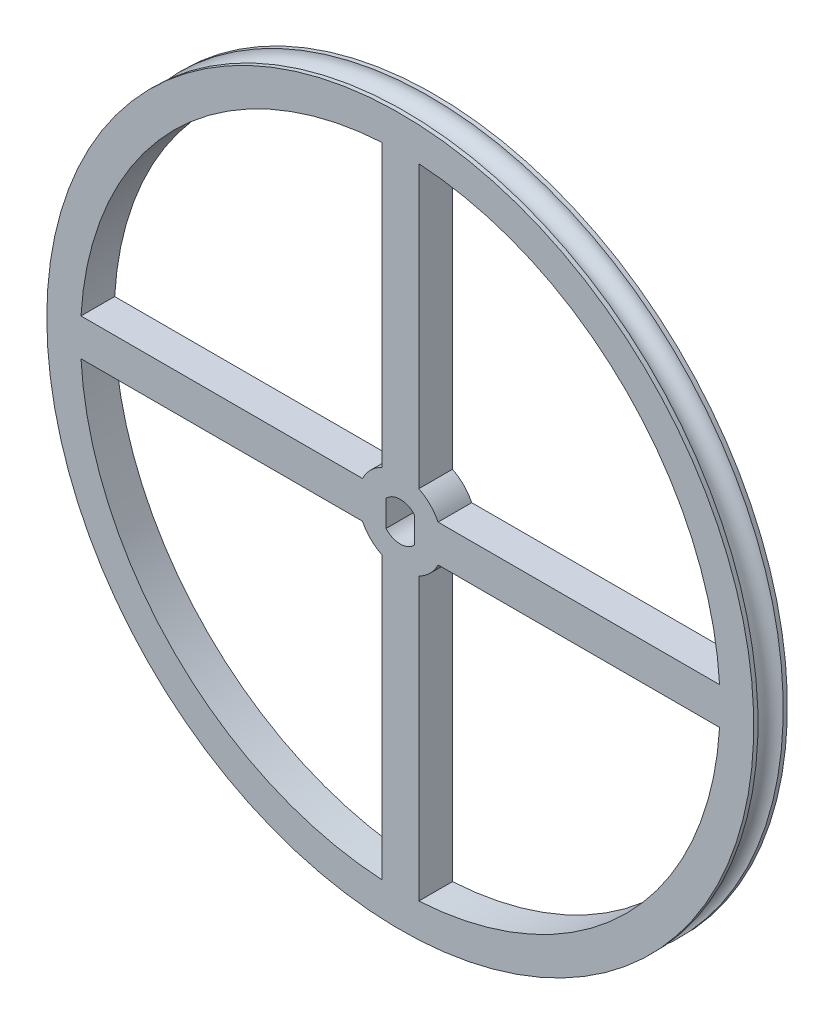
from build123d import *

# Parameters (mm, degrees)
CUT_EXTRUDE2_DEPTH = 76.605010416
CUT_EXTRUDE3_DEPTH = 76.605010416


with BuildPart() as part:
    # Sketch1 → Revolve1 (revolve)
    with BuildSketch(Plane(origin=(0, 0, 0), x_dir=(1, 0, 0), z_dir=(0, 1, 0))):
        with BuildLine():
            Line((-53.34, 0), (-53.34, -0.635))
            ThreePointArc((-53.34, -0.635), (-51.435, -2.54), (-53.34, -4.445))
            Line((-53.34, -4.445), (-53.34, -5.08))
            Line((-53.34, -5.08), (0, -5.08))
            Line((0, -5.08), (0, 0))
            Line((0, 0), (-53.34, 0))
        make_face()
    revolve(axis=Axis((0, 0, 0), (0, 0, 1)))

    # Sketch3 → Cut-Extrude2 (cut, through all)
    with BuildSketch(Plane(origin=(0, 0, 0), x_dir=(-1, 0, 0), z_dir=(0, 0, -1))):
        with BuildLine():
            Line((2.794, 48.179053166), (2.794, 5.702285857))
            ThreePointArc((2.794, 5.702285857), (4.490128061, 4.490128061), (5.702285857, 2.794))
            Line((5.702285857, 2.794), (48.179053166, 2.794))
            ThreePointArc((48.179053166, 2.794), (34.12497326, 34.12497326), (2.794, 48.179053166))
        make_face()
        with BuildLine():
            Line((2.794, -5.702285857), (2.794, -48.179053166))
            ThreePointArc((2.794, -48.179053166), (34.12497326, -34.12497326), (48.179053166, -2.794))
            Line((48.179053166, -2.794), (5.702285857, -2.794))
            ThreePointArc((5.702285857, -2.794), (4.490128061, -4.490128061), (2.794, -5.702285857))
        make_face()
        with BuildLine():
            Line((-5.702285857, -2.794), (-48.179053166, -2.794))
            ThreePointArc((-48.179053166, -2.794), (-34.12497326, -34.12497326), (-2.794, -48.179053166))
            Line((-2.794, -48.179053166), (-2.794, -5.702285857))
            ThreePointArc((-2.794, -5.702285857), (-4.490128061, -4.490128061), (-5.702285857, -2.794))
        make_face()
        with BuildLine():
            Line((-2.794, 5.702285857), (-2.794, 48.179053166))
            ThreePointArc((-2.794, 48.179053166), (-34.12497326, 34.12497326), (-48.179053166, 2.794))
            Line((-48.179053166, 2.794), (-5.702285857, 2.794))
            ThreePointArc((-5.702285857, 2.794), (-4.490128061, 4.490128061), (-2.794, 5.702285857))
        make_face()
    extrude(amount=-CUT_EXTRUDE2_DEPTH, mode=Mode.SUBTRACT)

    # Sketch6 → Cut-Extrude3 (cut, through all)
    with BuildSketch(Plane(origin=(0, 0, 0), x_dir=(-1, 0, 0), z_dir=(0, 0, -1))):
        with BuildLine():
            Line((-2.159, 1.96747554), (-2.159, -1.96747554))
            ThreePointArc((-2.159, -1.96747554), (0, -2.921), (2.159, -1.96747554))
            Line((2.159, -1.96747554), (2.159, 1.96747554))
            ThreePointArc((2.159, 1.96747554), (0, 2.921), (-2.159, 1.96747554))
        make_face()
    extrude(amount=-CUT_EXTRUDE3_DEPTH, mode=Mode.SUBTRACT)


solid = part.part
